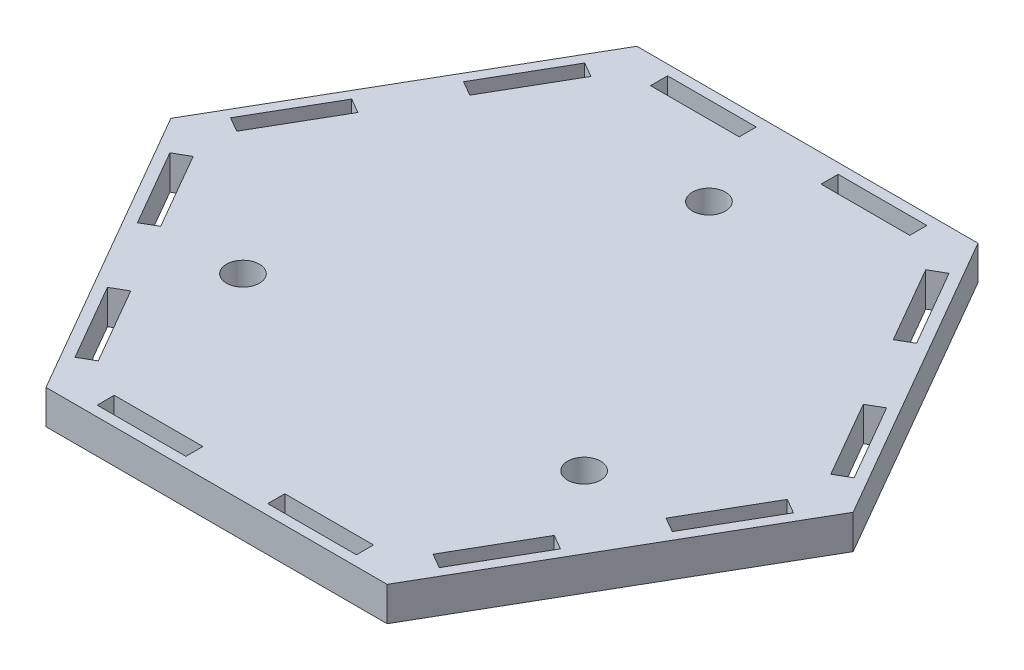
from build123d import *

# Parameters (mm, degrees)
BOSS_EXTRUDE1_DEPTH = 6.35
SKETCH2_R           = 3.0734
SKETCH2_W           = 16.51
SKETCH2_H           = 3.175
CUT_EXTRUDE1_DEPTH  = 85.242269675


with BuildPart() as part:
    # Sketch1 → Boss-Extrude1 (new body)
    with BuildSketch(Plane(origin=(0, 0, 0), x_dir=(1, 0, 0), z_dir=(0, 1, 0))):
        Polygon((-63.5, 0), (-31.75, -54.99261314), (31.75, -54.99261314), (63.5, 0), (31.75, 54.99261314), (-31.75, 54.99261314), align=None)
    extrude(amount=BOSS_EXTRUDE1_DEPTH)

    # Sketch2 → Cut-Extrude1 (cut, through all)
    with BuildSketch(Plane(origin=(0, 6.35, 0), x_dir=(1, 0, 0), z_dir=(0, 1, 0))):
        with Locations((-31.75, -18.330871047)):
            Circle(SKETCH2_R)
        with Locations((0, 36.661742094)):
            Circle(SKETCH2_R)
        with Locations((31.75, -18.330871047)):
            Circle(SKETCH2_R)
        Polygon((-55.290590949, -4.059113577), (-58.040221606, -5.646613577), (-49.785221606, -19.944692993), (-47.035590949, -18.357192993), align=None)
        Polygon((-31.160590949, -45.853499563), (-33.910221606, -47.440999563), (-42.165221606, -33.142920147), (-39.415590949, -31.555420147), align=None)
        Polygon((-31.160590949, 45.853499563), (-33.910221606, 47.440999563), (-42.165221606, 33.142920147), (-39.415590949, 31.555420147), align=None)
        Polygon((-49.785221606, 19.944692993), (-47.035590949, 18.357192993), (-55.290590949, 4.059113577), (-58.040221606, 5.646613577), align=None)
        with Locations((15.875, 51.50011314)):
            Rectangle(SKETCH2_W, SKETCH2_H)
        with Locations((-15.875, 51.50011314)):
            Rectangle(SKETCH2_W, SKETCH2_H)
        Polygon((55.290590949, 4.059113577), (58.040221606, 5.646613577), (49.785221606, 19.944692993), (47.035590949, 18.357192993), align=None)
        Polygon((42.165221606, 33.142920147), (39.415590949, 31.555420147), (31.160590949, 45.853499563), (33.910221606, 47.440999563), align=None)
        Polygon((31.160590949, -45.853499563), (33.910221606, -47.440999563), (42.165221606, -33.142920147), (39.415590949, -31.555420147), align=None)
        Polygon((49.785221606, -19.944692993), (47.035590949, -18.357192993), (55.290590949, -4.059113577), (58.040221606, -5.646613577), align=None)
        with Locations((-15.875, -51.50011314)):
            Rectangle(SKETCH2_W, SKETCH2_H)
        with Locations((15.875, -51.50011314)):
            Rectangle(SKETCH2_W, SKETCH2_H)
    extrude(amount=-CUT_EXTRUDE1_DEPTH, mode=Mode.SUBTRACT)


solid = part.part
